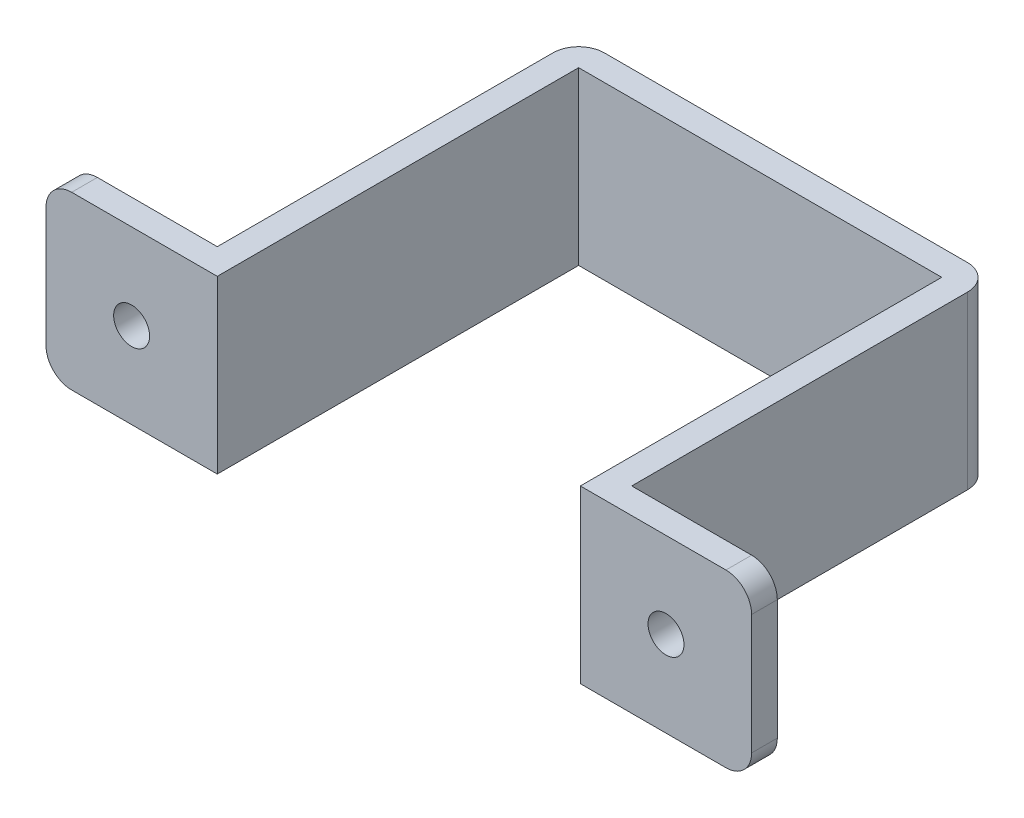
from build123d import *

# Parameters (mm, degrees)
EXTRUDE_1_DEPTH     = 20
FILLET_1_R          = 3
FILLET_2_R          = 3
SKETCH_3_R          = 2.1
CUT_EXTRUDE_1_DEPTH = 10


with BuildPart() as part:
    # 草图1 → 凸台-拉伸1 (new body)
    with BuildSketch(Plane(origin=(0, 0, 0), x_dir=(1, 0, 0), z_dir=(0, 1, 0))):
        Polygon((-21.2, 6.013269655), (-21.2, 0), (-41.2, 0), (-41.2, 3), (-24.2, 3), (-24.2, 45.2), (24.2, 45.2), (24.2, 3), (41.2, 3), (41.2, 0), (21.2, 0), (21.2, 6.013269655), (21.2, 42.2), (-21.2, 42.2), align=None)
    extrude(amount=EXTRUDE_1_DEPTH)

    # 圆角1
    fillet_1_edges = [part.edges().sort_by_distance(p)[0] for p in [
        (-24.2, 10, -45.2),
        (24.2, 10, -45.2),
    ]]
    fillet(fillet_1_edges, radius=FILLET_1_R)

    # 圆角2
    fillet_2_edges = [part.edges().sort_by_distance(p)[0] for p in [
        (-41.2, 0, -1.5),
        (-41.2, 20, -1.5),
        (41.2, 0, -1.5),
        (41.2, 20, -1.5),
    ]]
    fillet(fillet_2_edges, radius=FILLET_2_R)

    # 草图3 → 切除-拉伸1 (cut)
    with BuildSketch(Plane(origin=(0, 0, -3), x_dir=(-1, 0, 0), z_dir=(0, 0, -1))):
        with Locations((31.2, 10)):
            Circle(SKETCH_3_R)
        with Locations((-31.2, 10)):
            Circle(SKETCH_3_R)
    extrude(amount=-CUT_EXTRUDE_1_DEPTH, mode=Mode.SUBTRACT)


solid = part.part
